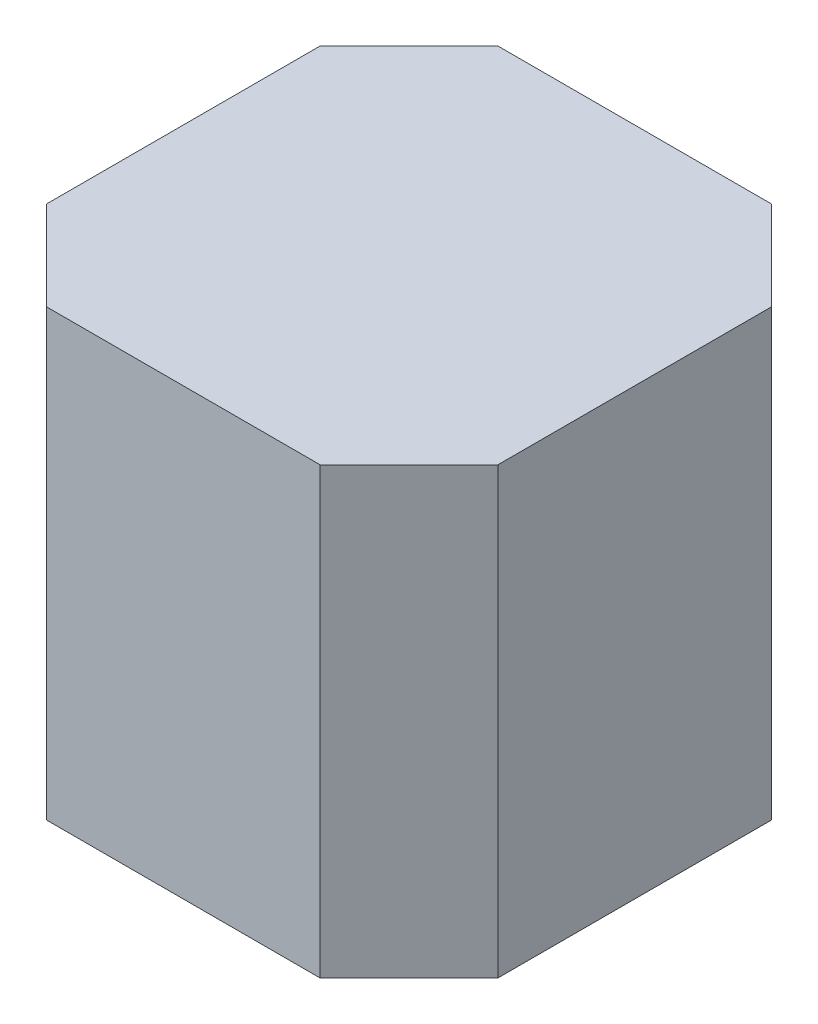
from build123d import *

# Parameters (mm, degrees)
SKETCH_1_W      = 2.54
SKETCH_1_H      = 2.54
EXTRUDE_1_DEPTH = 2.5
CHAMFER_1_SIZE  = 0.5


with BuildPart() as part:
    # Эскиз1 → Бобышка-Вытянуть1 (new body)
    with BuildSketch(Plane(origin=(0, 0, 0), x_dir=(1, 0, 0), z_dir=(0, 1, 0))):
        Rectangle(SKETCH_1_W, SKETCH_1_H)
    extrude(amount=EXTRUDE_1_DEPTH)

    # Фаска1
    chamfer_1_edges = [part.edges().sort_by_distance(p)[0] for p in [
        (-1.27, 1.25, -1.27),
        (-1.27, 1.25, 1.27),
        (1.27, 1.25, 1.27),
        (1.27, 1.25, -1.27),
    ]]
    chamfer(chamfer_1_edges, length=CHAMFER_1_SIZE)


solid = part.part
